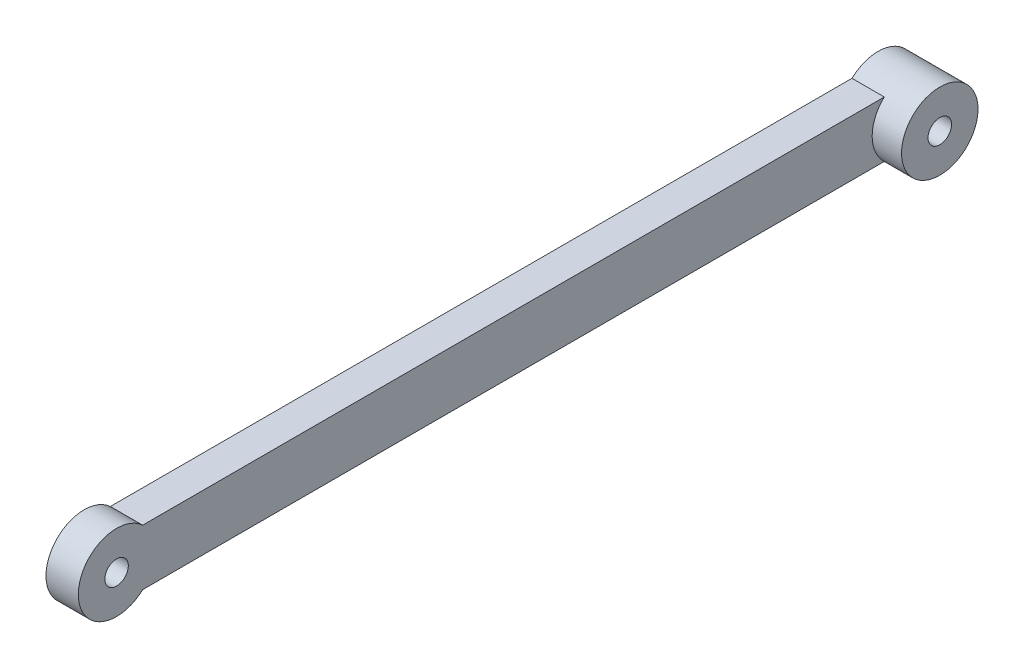
from build123d import *

# Parameters (mm, degrees)
SKETCH1_R           = 2
BOSS_EXTRUDE1_DEPTH = 5.5
SKETCH2_R           = 6.5
SKETCH2_R_2         = 2
BOSS_EXTRUDE3_DEPTH = 5


with BuildPart() as part:
    # Sketch1 → Boss-Extrude1 (new body)
    with BuildSketch(Plane(origin=(0, 0, 0), x_dir=(0, 0, -1), z_dir=(1, 0, 0))):
        with BuildLine():
            Line((4.43706, 4.75), (130.56294, 4.75))
            ThreePointArc((130.56294, 4.75), (141.5, 0), (130.56294, -4.75))
            Line((130.56294, -4.75), (4.43706, -4.75))
            ThreePointArc((4.43706, -4.75), (-6.5, 0), (4.43706, 4.75))
        make_face()
        Circle(SKETCH1_R, mode=Mode.SUBTRACT)
        with Locations((135, 0)):
            Circle(SKETCH1_R, mode=Mode.SUBTRACT)
    extrude(amount=BOSS_EXTRUDE1_DEPTH)

    # Sketch2 → Boss-Extrude3 (add)
    with BuildSketch(Plane(origin=(5.5, 0, 0), x_dir=(0, 0, -1), z_dir=(1, 0, 0))):
        with Locations((135, 0)):
            Circle(SKETCH2_R)
        with Locations((135, 0)):
            Circle(SKETCH2_R_2, mode=Mode.SUBTRACT)
    extrude(amount=BOSS_EXTRUDE3_DEPTH)


solid = part.part
